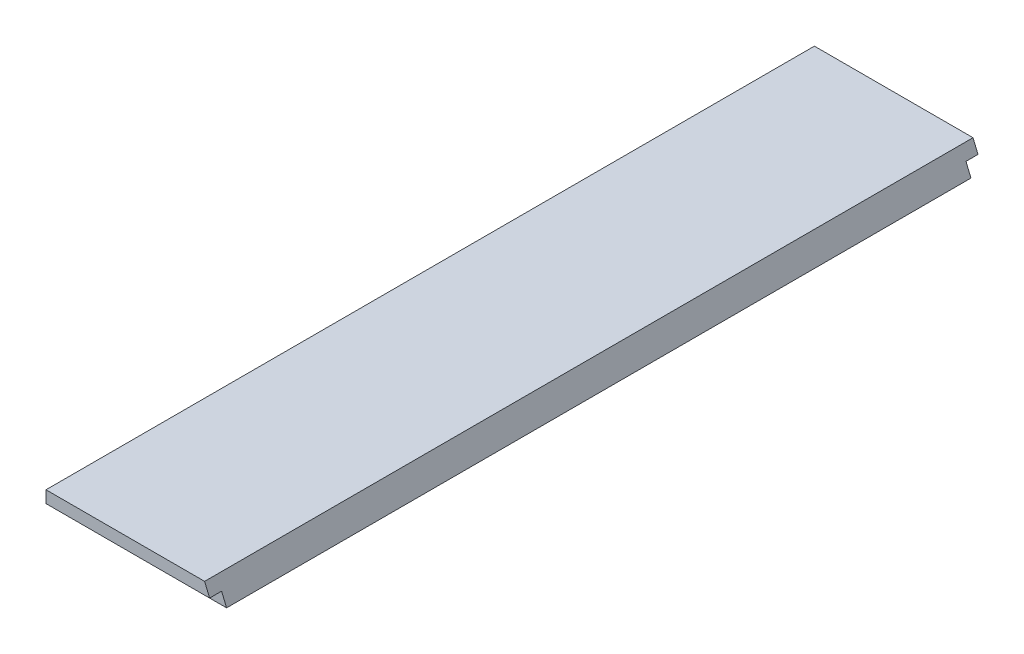
from build123d import *

# Parameters (mm, degrees)
BOSS_EXTRUDE1_DEPTH = 406.4
SKETCH2_W           = 89.154
SKETCH2_H           = 6.35
CUT_EXTRUDE1_DEPTH  = 6.35


with BuildPart() as part:
    # Sketch1 → Boss-Extrude1 (new body)
    with BuildSketch(Plane.XY):
        Polygon((0, 0), (0, 12.7), (83.893487758, 12.7), (89.154, 0), align=None)
    extrude(amount=BOSS_EXTRUDE1_DEPTH)

    # Sketch2 → Cut-Extrude1 (cut)
    with BuildSketch(Plane.XZ):
        with Locations((44.577, 3.175)):
            Rectangle(SKETCH2_W, SKETCH2_H)
        with Locations((44.577, 403.225)):
            Rectangle(SKETCH2_W, SKETCH2_H)
    extrude(amount=-CUT_EXTRUDE1_DEPTH, mode=Mode.SUBTRACT)


solid = part.part
